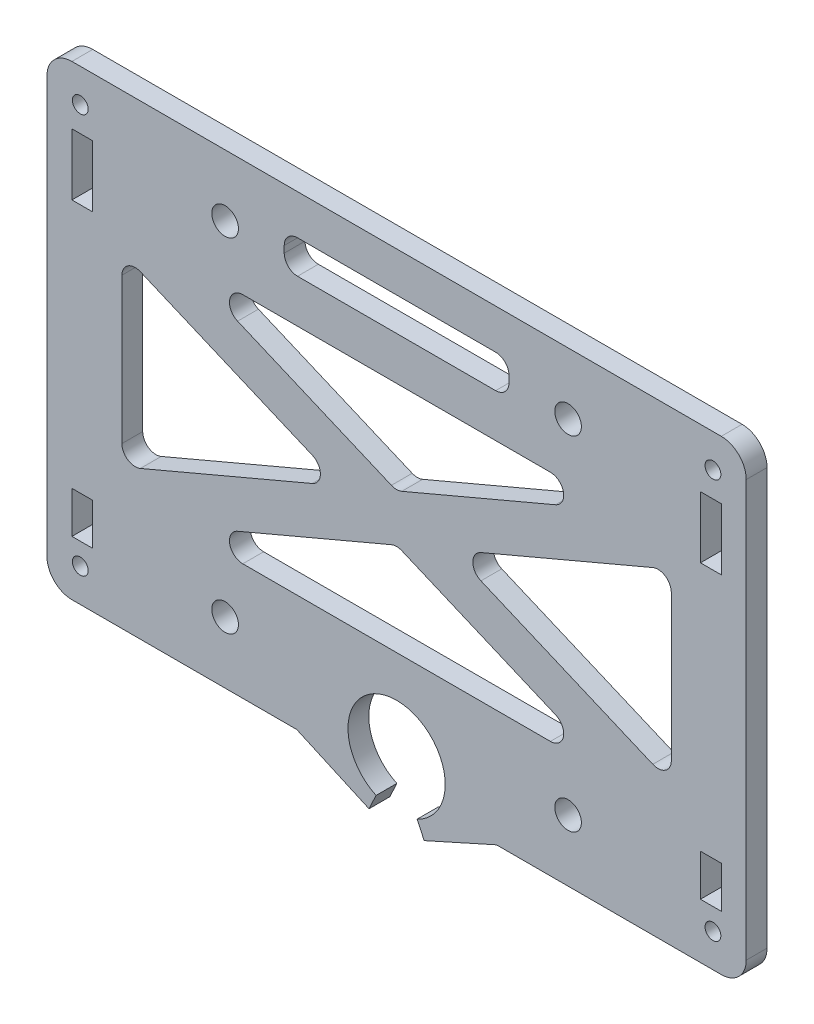
from build123d import *

# Parameters (mm, degrees)
SKETCH1_R           = 0.60325
SKETCH1_R_2         = 1.016
BOSS_EXTRUDE1_DEPTH = 1.5875
SPEED_HOLES_REACH   = 35.53
SKETCH2_W           = 17.145
SKETCH2_H           = 2.54
FILLET1_R           = 1.016
SKETCH5_W           = 1.5875
SKETCH5_H           = 3.175
SKETCH5_H_2         = 4.699
CUT_EXTRUDE1_DEPTH  = 34.530212411


with BuildPart() as part:
    # Sketch1 → Boss-Extrude1 (new body)
    with BuildSketch(Plane.XY):
        with BuildLine():
            ThreePointArc((26.67, 15.875), (26.112038418, 17.222038418), (24.765, 17.78))
            Line((24.765, 17.78), (-24.765, 17.78))
            ThreePointArc((-24.765, 17.78), (-26.112038418, 17.222038418), (-26.67, 15.875))
            Line((-26.67, 15.875), (-26.67, -15.875))
            ThreePointArc((-26.67, -15.875), (-26.112038418, -17.222038418), (-24.765, -17.78))
            Line((-24.765, -17.78), (-7.62, -17.78))
            Line((-7.62, -17.78), (-2.103962754, -20.259962687))
            Line((-2.103962754, -20.259962687), (-1.567237562, -19.108951797))
            ThreePointArc((-1.567237562, -19.108951797), (0, -12.0396), (1.567237562, -19.108951797))
            Line((1.567237562, -19.108951797), (2.103962754, -20.259962687))
            Line((2.103962754, -20.259962687), (7.62, -17.78))
            Line((7.62, -17.78), (24.765, -17.78))
            ThreePointArc((24.765, -17.78), (26.112038418, -17.222038418), (26.67, -15.875))
            Line((26.67, -15.875), (26.67, 15.875))
        make_face()
        with Locations((-24.13, -15.24)):
            Circle(SKETCH1_R, mode=Mode.SUBTRACT)
        with Locations((-13.08, -13.08)):
            Circle(SKETCH1_R_2, mode=Mode.SUBTRACT)
        with Locations((13.08, -13.08)):
            Circle(SKETCH1_R_2, mode=Mode.SUBTRACT)
        with Locations((24.13, -15.24)):
            Circle(SKETCH1_R, mode=Mode.SUBTRACT)
        with Locations((-24.13, 15.24)):
            Circle(SKETCH1_R, mode=Mode.SUBTRACT)
        with Locations((-13.08, 13.08)):
            Circle(SKETCH1_R_2, mode=Mode.SUBTRACT)
        with Locations((13.08, 13.08)):
            Circle(SKETCH1_R_2, mode=Mode.SUBTRACT)
        with Locations((24.13, 15.24)):
            Circle(SKETCH1_R, mode=Mode.SUBTRACT)
    extrude(amount=BOSS_EXTRUDE1_DEPTH)

    # Sketch2 → Speed Holes (cut, up to next)
    with BuildSketch(Plane.XY.offset(1.5875), mode=Mode.PRIVATE) as speed_holes_sk1:
        Polygon((4.227373313, 0), (20.955, -7.096568898), (20.955, 7.096568898), align=None)
    speed_holes_tool1 = extrude(speed_holes_sk1.sketch, amount=-SPEED_HOLES_REACH, mode=Mode.PRIVATE) & part.part
    # Sketch2 → Speed Holes (cut, up to next)
    with BuildSketch(Plane.XY.offset(1.5875), mode=Mode.PRIVATE) as speed_holes_sk2:
        Polygon((-16.727626687, 8.89), (0, 1.793431102), (16.727626687, 8.89), align=None)
    speed_holes_tool2 = extrude(speed_holes_sk2.sketch, amount=-SPEED_HOLES_REACH, mode=Mode.PRIVATE) & part.part
    # Sketch2 → Speed Holes (cut, up to next)
    with BuildSketch(Plane.XY.offset(1.5875), mode=Mode.PRIVATE) as speed_holes_sk3:
        Polygon((16.727626687, -8.89), (0, -1.793431102), (-16.727626687, -8.89), align=None)
    speed_holes_tool3 = extrude(speed_holes_sk3.sketch, amount=-SPEED_HOLES_REACH, mode=Mode.PRIVATE) & part.part
    # Sketch2 → Speed Holes (cut, up to next)
    with BuildSketch(Plane.XY.offset(1.5875), mode=Mode.PRIVATE) as speed_holes_sk4:
        Polygon((-20.955, -7.096568898), (-4.227373313, 0), (-20.955, 7.096568898), align=None)
    speed_holes_tool4 = extrude(speed_holes_sk4.sketch, amount=-SPEED_HOLES_REACH, mode=Mode.PRIVATE) & part.part
    # Sketch2 → Speed Holes (cut, up to next)
    with BuildSketch(Plane.XY.offset(1.5875), mode=Mode.PRIVATE) as speed_holes_sk5:
        with Locations((0, 13.462)):
            Rectangle(SKETCH2_W, SKETCH2_H)
    speed_holes_tool5 = extrude(speed_holes_sk5.sketch, amount=-SPEED_HOLES_REACH, mode=Mode.PRIVATE) & part.part
    add(speed_holes_tool1.solids().sort_by_distance((15.379124, 0, 1.5875))[0], mode=Mode.SUBTRACT)
    add(speed_holes_tool2.solids().sort_by_distance((0, 6.524477, 1.5875))[0], mode=Mode.SUBTRACT)
    add(speed_holes_tool3.solids().sort_by_distance((0, -6.524477, 1.5875))[0], mode=Mode.SUBTRACT)
    add(speed_holes_tool4.solids().sort_by_distance((-15.379124, 0, 1.5875))[0], mode=Mode.SUBTRACT)
    add(speed_holes_tool5.solids().sort_by_distance((0, 13.462, 1.5875))[0], mode=Mode.SUBTRACT)

    # Fillet1
    fillet1_edges = [part.edges().sort_by_distance(p)[0] for p in [
        (-16.727626687, -8.89, 0.79375),
        (-20.955, -7.096568898, 0.79375),
        (0, 1.793431102, 0.79375),
        (16.727626687, -8.89, 0.79375),
        (20.955, -7.096568898, 0.79375),
        (20.955, 7.096568898, 0.79375),
        (-4.227373313, 0, 0.79375),
        (16.727626687, 8.89, 0.79375),
        (4.227373313, 0, 0.79375),
        (-16.727626687, 8.89, 0.79375),
        (0, -1.793431102, 0.79375),
        (-20.955, 7.096568898, 0.79375),
        (-8.5725, 14.732, 0.79375),
        (-8.5725, 12.192, 0.79375),
        (8.5725, 14.732, 0.79375),
        (8.5725, 12.192, 0.79375),
    ]]
    fillet(fillet1_edges, radius=FILLET1_R)

    # Sketch5 → Cut-Extrude1 (cut, through all)
    with BuildSketch(Plane.XY.offset(1.5875)):
        with Locations((23.97125, -12.008655036)):
            Rectangle(SKETCH5_W, SKETCH5_H)
        with Locations((23.97125, 10.978344964)):
            Rectangle(SKETCH5_W, SKETCH5_H_2)
    cut_extrude1 = extrude(amount=-CUT_EXTRUDE1_DEPTH, mode=Mode.SUBTRACT)

    # Mirror1: Cut-Extrude1 across plane
    add(cut_extrude1.mirror(Plane(origin=(0, 0, 0), x_dir=(0, 0, 1), z_dir=(1, 0, 0))), mode=Mode.SUBTRACT)


solid = part.part
